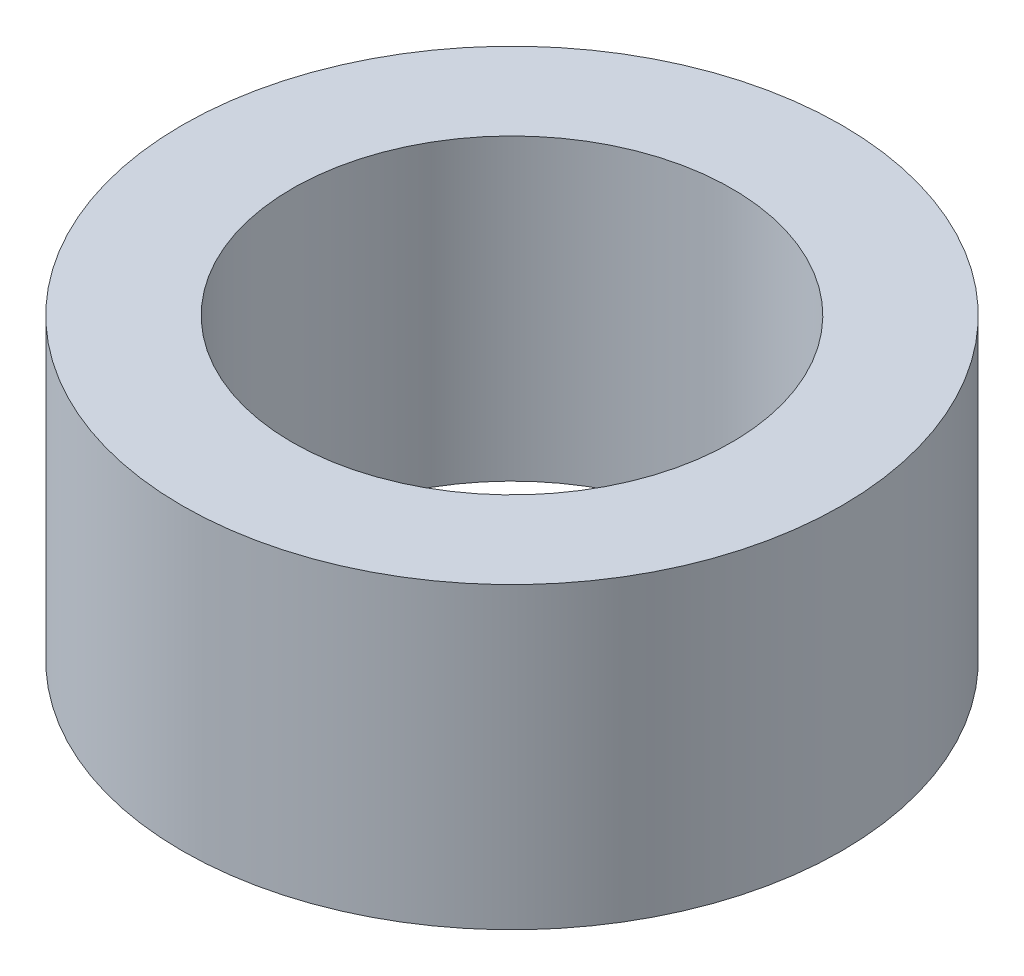
from build123d import *

# Parameters (mm, degrees)
SKETCH1_R           = 4.7625
SKETCH1_R_2         = 3.175
BOSS_EXTRUDE1_DEPTH = 4.318


with BuildPart() as part:
    # Sketch1 → Boss-Extrude1 (new body)
    with BuildSketch(Plane(origin=(0, 0, 0), x_dir=(1, 0, 0), z_dir=(0, 1, 0))):
        Circle(SKETCH1_R)
        Circle(SKETCH1_R_2, mode=Mode.SUBTRACT)
    extrude(amount=BOSS_EXTRUDE1_DEPTH)


solid = part.part
